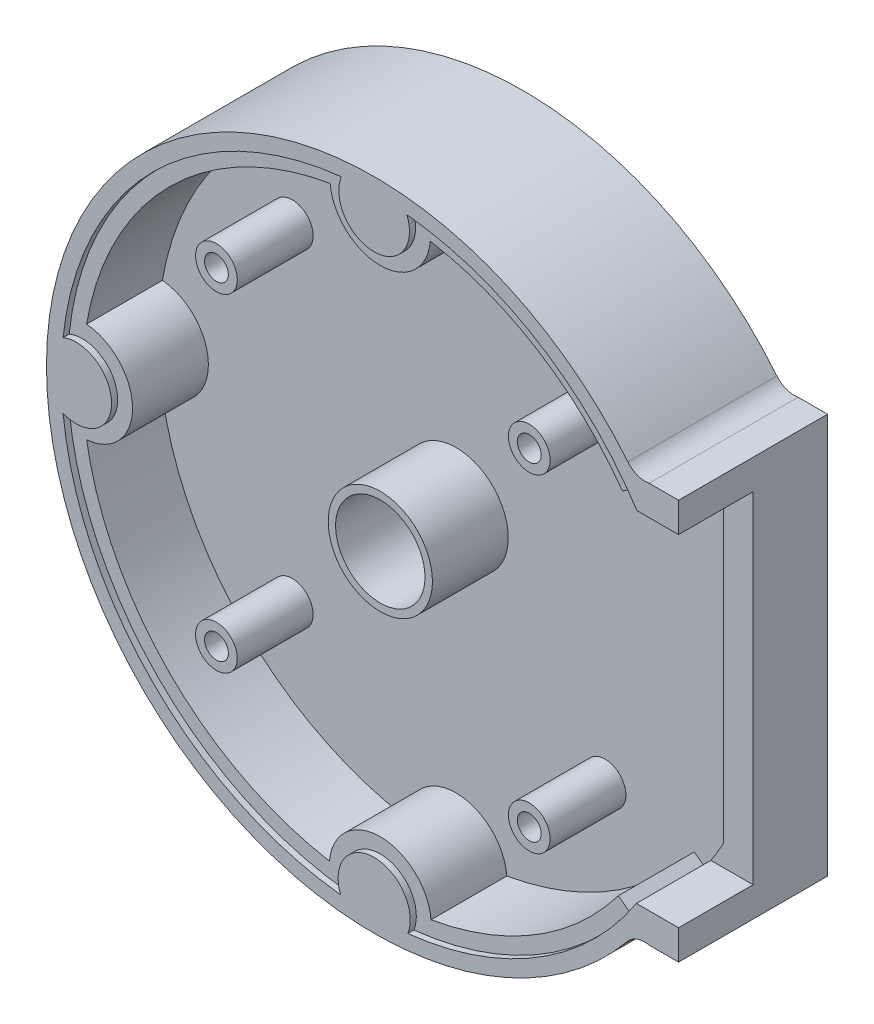
from build123d import *

# Parameters (mm, degrees)
SKETCH2_R                 = 22
BOSS_EXTRUDE1_DEPTH       = 10
SKETCH3_R                 = 21
CUT_EXTRUDE2_DEPTH        = 5.5
SKETCH4_R                 = 1.4
SKETCH4_R_2               = 0.8
BOSS_EXTRUDE2_DEPTH       = 5.09
SKETCH5_R                 = 3
CUT_EXTRUDE3_DEPTH        = 13
BOSS_EXTRUDE3_START       = 5.09
SKETCH6_R                 = 3.5
SKETCH6_R_2               = 3
BOSS_EXTRUDE3_DEPTH       = 5.09
SKETCH18_R                = 0.8
CUT_EXTRUDE7_DEPTH        = 33.557151288
SKETCH20_W                = 10.090622296
SKETCH20_H                = 22.853546686
CUT_EXTRUDE8_DEPTH        = 5
BOSS_EXTRUDE12_DEPTH      = 0.5
BOSS_EXTRUDE12_DEPTH_BACK = 2
FILLET3_R                 = 1.5
CUT_EXTRUDE9_REACH        = 34.68
SKETCH25_W                = 14.266365092
SKETCH25_H                = 28.452518254
BOSS_EXTRUDE14_START      = 5.5
BOSS_EXTRUDE14_DEPTH      = 5.5
BOSS_EXTRUDE15_START      = 5.09
BOSS_EXTRUDE15_DEPTH      = 5.09
SKETCH36_R                = 0.8
CUT_EXTRUDE10_DEPTH       = 2.5


with BuildPart() as part:
    # Sketch2 → Boss-Extrude1 (new body)
    with BuildSketch(Plane.XY):
        Circle(SKETCH2_R)
    extrude(amount=BOSS_EXTRUDE1_DEPTH)

    # Sketch3 → Cut-Extrude2 (cut)
    with BuildSketch(Plane.XY.offset(10)):
        Circle(SKETCH3_R)
    extrude(amount=-CUT_EXTRUDE2_DEPTH, mode=Mode.SUBTRACT)

    # Sketch4 → Boss-Extrude2 (add)
    # profile 1 of 4: a face of its own
    with BuildSketch(Plane.XY.offset(4.5)):
        with Locations((-11, 11)):
            Circle(SKETCH4_R)
        with Locations((-11, 11)):
            Circle(SKETCH4_R_2, mode=Mode.SUBTRACT)
    # profile 2 of 4: a face of its own
    with BuildSketch(Plane.XY.offset(4.5)):
        with Locations((10, 11)):
            Circle(SKETCH4_R)
        with Locations((10, 11)):
            Circle(SKETCH4_R_2, mode=Mode.SUBTRACT)
    # profile 3 of 4: a face of its own
    with BuildSketch(Plane.XY.offset(4.5)):
        with Locations((10, -11.015029648)):
            Circle(SKETCH4_R)
        with Locations((10, -11.015029648)):
            Circle(SKETCH4_R_2, mode=Mode.SUBTRACT)
    # profile 4 of 4: a face of its own
    with BuildSketch(Plane.XY.offset(4.5)):
        with Locations((-11, -11.015029648)):
            Circle(SKETCH4_R)
        with Locations((-11, -11.015029648)):
            Circle(SKETCH4_R_2, mode=Mode.SUBTRACT)
    extrude(amount=BOSS_EXTRUDE2_DEPTH)

    # Sketch5 → Cut-Extrude3 (cut)
    with BuildSketch(Plane.XY.offset(4.5)):
        Circle(SKETCH5_R)
    extrude(amount=-CUT_EXTRUDE3_DEPTH, mode=Mode.SUBTRACT)

    # Sketch6 → Boss-Extrude3 (add)
    with BuildSketch(Plane.XY.offset(4.5).offset(BOSS_EXTRUDE3_START)):
        Circle(SKETCH6_R)
        Circle(SKETCH6_R_2, mode=Mode.SUBTRACT)
    extrude(amount=-BOSS_EXTRUDE3_DEPTH)

    # Sketch18 → Cut-Extrude7 (cut, through all)
    with BuildSketch(Plane.XY.offset(9.59)):
        with Locations((-11, 11)):
            Circle(SKETCH18_R)
        with Locations((10, 11)):
            Circle(SKETCH18_R)
        with Locations((10, -11.015029648)):
            Circle(SKETCH18_R)
        with Locations((-11, -11.015029648)):
            Circle(SKETCH18_R)
    extrude(amount=-CUT_EXTRUDE7_DEPTH, mode=Mode.SUBTRACT)

    # Sketch20 → Cut-Extrude8 (cut)
    with BuildSketch(Plane.XY.offset(10)):
        with Locations((22.416150926, -0.026114621)):
            Rectangle(SKETCH20_W, SKETCH20_H)
    extrude(amount=-CUT_EXTRUDE8_DEPTH, mode=Mode.SUBTRACT)

    # Sketch24 → Boss-Extrude12 (add, two sides: drawn at the far end of the back side and taken through both)
    with BuildSketch(Plane(origin=(20.459151462, 0, 0), x_dir=(0, 0, -1), z_dir=(1, 0, 0)).offset(-BOSS_EXTRUDE12_DEPTH_BACK)):
        Polygon((-10, 11.400658722), (-5, 11.400658722), (-5, -11.452887964), (-10, -11.452887964), (-10, -13.452887964), (0, -13.452887964), (0, 13.400658722), (-10, 13.400658722), align=None)
    extrude(amount=BOSS_EXTRUDE12_DEPTH + BOSS_EXTRUDE12_DEPTH_BACK)

    # Fillet3
    # the kernel refuses this fillet: 1.5 mm, written as the material it adds along each edge
    with BuildSketch(Plane(origin=(18.459151462, -11.96911556, 10), x_dir=(-0.5904449589770525, -0.8070779085184941, 0), z_dir=(0, 0, -1))) as fillet3_piece_1:
        with BuildLine():
            CenterArc((2.562692726, -1.497618907), FILLET3_R, 93.228774065, 62.292501853)
            Line((1.197519929, -0.876085936), (1.170216473, -0.863655277))
            ThreePointArc((1.170216473, -0.863655277), (0.581046616, -0.462255305), (-0.017713349, -0.024212337))
            Line((-0.017713349, -0.024212337), (0.001689688, 0.029952378))
            ThreePointArc((0.001689688, 0.029952378), (1.239104175, -0.004922699), (2.476518663, 0.029952378))
            Line((2.476518663, 0.029952378), (2.47820835, 0))
        make_face()
    extrude(amount=10)
    with BuildSketch(Plane(origin=(18.459151462, 11.96911556, 10), x_dir=(0, 1, 0), z_dir=(0, 0, -1))) as fillet3_piece_2:
        with BuildLine():
            CenterArc((2.907499122, -0.267495804), FILLET3_R, 169.727466674, 60.997217104)
            Line((1.957927972, -1.428665314), (1.938936549, -1.451888704))
            ThreePointArc((1.938936549, -1.451888704), (0.980970205, -0.711583215), (-0.016321521, -0.02517157))
            Line((-0.016321521, -0.02517157), (0, 0.03))
            ThreePointArc((0, 0.03), (0.715771581, 0.03), (1.402024043, 0.005349916))
            Line((1.402024043, 0.005349916), (1.431543163, 0))
        make_face()
    extrude(amount=10)

    # Sketch25 → Cut-Extrude9 (cut, up to next)
    with BuildSketch(Plane.XY.offset(10), mode=Mode.PRIVATE) as cut_extrude9_sk1:
        with Locations((27.566848105, 0.101683084)):
            Rectangle(SKETCH25_W, SKETCH25_H)
    cut_extrude9_tool1 = extrude(cut_extrude9_sk1.sketch, amount=-CUT_EXTRUDE9_REACH, mode=Mode.PRIVATE) & part.part
    add(cut_extrude9_tool1.solids().sort_by_distance((27.566848, 0.101683, 10))[0], mode=Mode.SUBTRACT)

    # Sketch30 → Boss-Extrude14 (add)
    with BuildSketch(Plane.XY.offset(4.5).offset(BOSS_EXTRUDE14_START)):
        with BuildLine():
            ThreePointArc((2.255465854, -20.878526619), (-0.002066694, -17.580176404), (-2.260374676, -20.877995745))
            ThreePointArc((-2.260374676, -20.877995745), (-0.002468723, -20.999999855), (2.255465854, -20.878526619))
        make_face()
        with BuildLine():
            ThreePointArc((-2.203022296, 20.884125377), (-0.002233305, 17.624620846), (2.197729558, 20.884683019))
            ThreePointArc((2.197729558, 20.884683019), (-0.002661017, 20.999999831), (-2.203022296, 20.884125377))
        make_face()
        with BuildLine():
            ThreePointArc((-20.883881485, -2.205333104), (-17.630224728, -0.00211959), (-20.884411153, 2.200311519))
            ThreePointArc((-20.884411153, 2.200311519), (-20.999999848, -0.002524721), (-20.883881485, -2.205333104))
        make_face()
    extrude(amount=-BOSS_EXTRUDE14_DEPTH)

    # Sketch33 → Boss-Extrude15 (add)
    with BuildSketch(Plane.XY.offset(4.5).offset(BOSS_EXTRUDE15_START)):
        with BuildLine():
            Line((16.263091014, 11.640956604), (17.076245565, 12.223004435))
            ThreePointArc((17.076245565, 12.223004435), (10.565400997, 18.148617076), (2.197729558, 20.884683019))
            ThreePointArc((2.197729558, 20.884683019), (2.280216576, 20.643620919), (2.336378022, 20.395103458))
            ThreePointArc((2.336378022, 20.395103458), (-0.256894976, 17.638295394), (-2.203022296, 20.884125377))
            ThreePointArc((-2.203022296, 20.884125377), (-14.850206089, 14.848278658), (-20.884411153, 2.200311519))
            ThreePointArc((-20.884411153, 2.200311519), (-17.630224728, -0.00211959), (-20.883881485, -2.205333104))
            ThreePointArc((-20.883881485, -2.205333104), (-14.868800585, -14.82965843), (-2.260374676, -20.877995745))
            ThreePointArc((-2.260374676, -20.877995745), (-0.002066694, -17.580176404), (2.255465854, -20.878526619))
            ThreePointArc((2.255465854, -20.878526619), (10.376578748, -18.257234552), (16.784176211, -12.621070831))
            Line((16.784176211, -12.621070831), (15.984929724, -12.020067458))
            ThreePointArc((15.984929724, -12.020067458), (10.430037734, -17.065002575), (3.406904238, -19.707688944))
            ThreePointArc((3.406904238, -19.707688944), (-0.001949136, -16.580176411), (-3.411537746, -19.70688738))
            ThreePointArc((-3.411537746, -19.70688738), (-14.159639755, -14.1246098), (-19.715277269, -3.362713518))
            ThreePointArc((-19.715277269, -3.362713518), (-16.630224735, -0.001999366), (-19.716085262, 3.35797289))
            ThreePointArc((-19.716085262, 3.35797289), (-14.144029066, 14.140241928), (-3.36325256, 19.71518532))
            ThreePointArc((-3.36325256, 19.71518532), (-0.00210659, 16.624620854), (3.358256029, 19.716037037))
            ThreePointArc((3.358256029, 19.716037037), (10.609007774, 16.954319628), (16.263091014, 11.640956604))
        make_face()
    extrude(amount=-BOSS_EXTRUDE15_DEPTH)

    # Sketch36 → Cut-Extrude10 (cut)
    # profile 1 of 4: a face of its own
    with BuildSketch(Plane(origin=(0, 0, 0), x_dir=(-1, 0, 0), z_dir=(0, 0, -1))):
        Polygon((-7.74833395, 11), (-8.874166975, 12.95), (-11.125833025, 12.95), (-12.25166605, 11), (-11.125833025, 9.05), (-8.874166975, 9.05), align=None)
        with Locations((-10, 11)):
            Circle(SKETCH36_R, mode=Mode.SUBTRACT)
    # profile 2 of 4: a face of its own
    with BuildSketch(Plane(origin=(0, 0, 0), x_dir=(-1, 0, 0), z_dir=(0, 0, -1))):
        Polygon((12.514649012, 12.666084743), (10.314452793, 13.144766893), (8.799803782, 11.47868215), (9.485350988, 9.333915257), (11.685547207, 8.855233107), (13.200196218, 10.52131785), align=None)
        with Locations((11, 11)):
            Circle(SKETCH36_R, mode=Mode.SUBTRACT)
    # profile 3 of 4: a face of its own
    with BuildSketch(Plane(origin=(0, 0, 0), x_dir=(-1, 0, 0), z_dir=(0, 0, -1))):
        Polygon((13.122597825, -10.263645278), (11.41058096, -8.801113824), (9.287983135, -9.552498195), (8.877402175, -11.766414018), (10.58941904, -13.228945472), (12.712016865, -12.477561101), align=None)
        with Locations((11, -11.015029648)):
            Circle(SKETCH36_R, mode=Mode.SUBTRACT)
    # profile 4 of 4: a face of its own
    with BuildSketch(Plane(origin=(0, 0, 0), x_dir=(-1, 0, 0), z_dir=(0, 0, -1))):
        Polygon((-8.492299155, -9.342654641), (-10.694468818, -8.873134912), (-12.202169663, -10.545509919), (-11.507700845, -12.687404655), (-9.305531182, -13.156924384), (-7.797830337, -11.484549377), align=None)
        with Locations((-10, -11.015029648)):
            Circle(SKETCH36_R, mode=Mode.SUBTRACT)
    extrude(amount=-CUT_EXTRUDE10_DEPTH, mode=Mode.SUBTRACT)


solid = part.part
